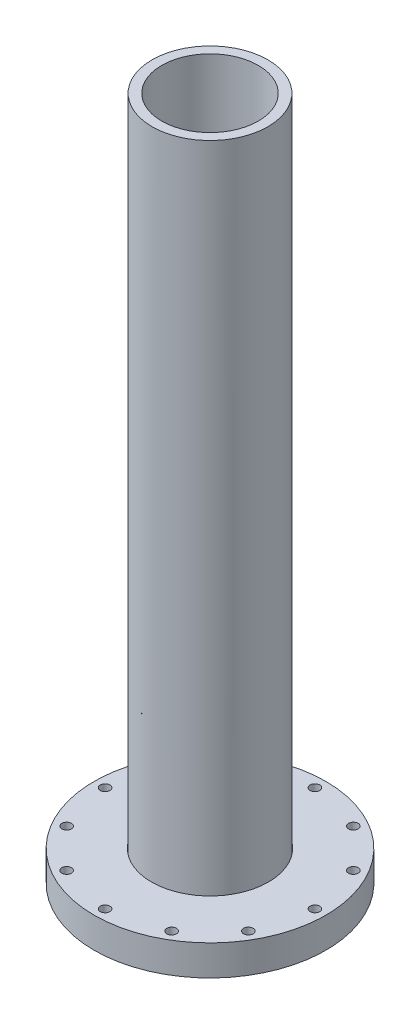
from build123d import *

# Parameters (mm, degrees)
SKETCH1_R           = 38.1
SKETCH1_R_2         = 31.75
BOSS_EXTRUDE1_DEPTH = 450
SKETCH2_R           = 76.2
SKETCH2_R_2         = 38.4556
BOSS_EXTRUDE2_DEPTH = 20
SKETCH5_W           = 3.175
SKETCH5_H           = 450
CIRPATTERN1_COUNT   = 12
SKETCH6_R           = 55.14
CUT_EXTRUDE1_DEPTH  = 2


with BuildPart() as part:
    # Sketch1 → Boss-Extrude1 (new body)
    with BuildSketch(Plane(origin=(0, 0, 0), x_dir=(1, 0, 0), z_dir=(0, 1, 0))):
        Circle(SKETCH1_R)
        Circle(SKETCH1_R_2, mode=Mode.SUBTRACT)
    extrude(amount=BOSS_EXTRUDE1_DEPTH)


with BuildPart() as body_2:
    # Sketch2 → Boss-Extrude2 (new body)
    with BuildSketch(Plane(origin=(0, 0, 0), x_dir=(1, 0, 0), z_dir=(0, 1, 0))):
        Circle(SKETCH2_R)
        Circle(SKETCH2_R_2, mode=Mode.SUBTRACT)
    extrude(amount=BOSS_EXTRUDE2_DEPTH)

    # Sketch5 → 1/4 (0.25) Diameter Hole1 (revolve, cut)
    with BuildSketch(Plane(origin=(69, 0, 0), x_dir=(0, 0, -1), z_dir=(1, 0, 0))):
        with Locations((1.5875, 225)):
            Rectangle(SKETCH5_W, SKETCH5_H)
    f_1_4_0_25_diameter_hole1 = revolve(axis=Axis((69, -6.35, 0), (0, 1, 0)), mode=Mode.SUBTRACT)

    # CirPattern1: 1/4 (0.25) Diameter Hole1 ×12 about axis
    cirpattern1_axis = Axis((0, 472.5, 0), (0, -1, 0))
    for i in range(1, CIRPATTERN1_COUNT):
        add(f_1_4_0_25_diameter_hole1.rotate(cirpattern1_axis, i * 360 / CIRPATTERN1_COUNT), mode=Mode.SUBTRACT)


with BuildPart() as cut_extrude1_tool:
    # Sketch6 → Cut-Extrude1 (new body)
    with BuildSketch(Plane.XZ):
        Circle(SKETCH6_R)
    extrude(amount=-CUT_EXTRUDE1_DEPTH)


with BuildPart() as part_1:
    add(part.part)

    # Cut-Extrude1: cut by cut_extrude1_tool
    add(cut_extrude1_tool.part, mode=Mode.SUBTRACT)


with BuildPart() as body_2_1:
    add(body_2.part)

    # Cut-Extrude1: cut by cut_extrude1_tool
    add(cut_extrude1_tool.part, mode=Mode.SUBTRACT)


solid = Compound([part_1.part, body_2_1.part])
